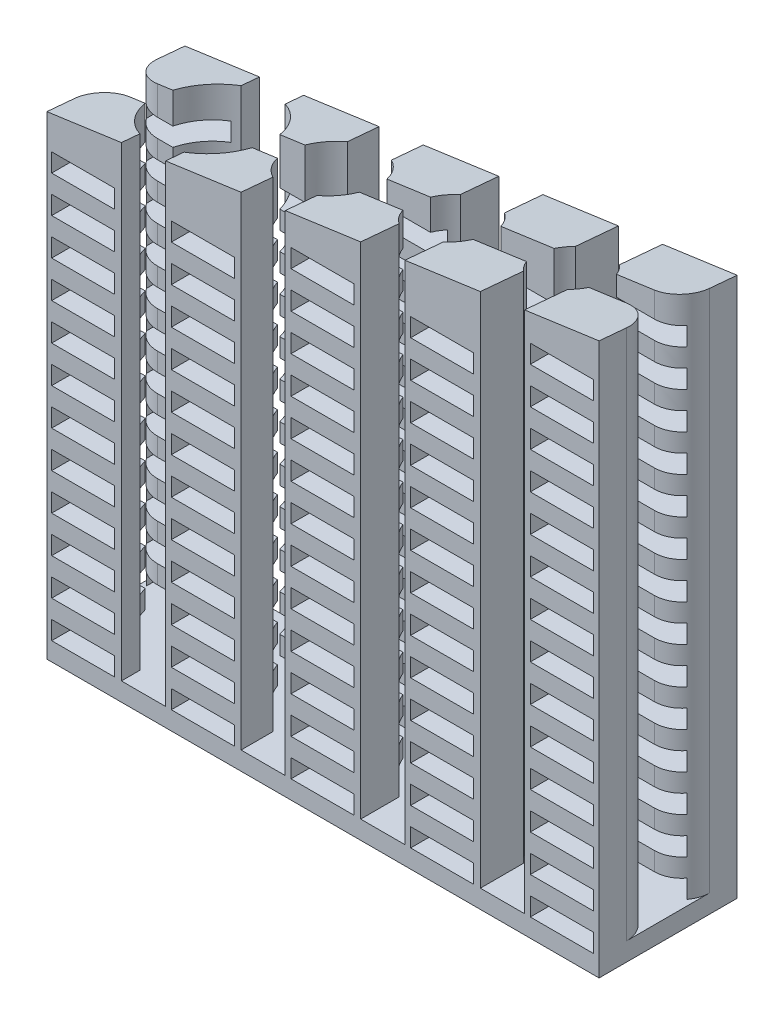
from build123d import *

# Parameters (mm, degrees)
SKETCH2_W            = 152.4
SKETCH2_H            = 38.1
BOSS_EXTRUDE1_DEPTH  = 152.4
SKETCH3_R            = 9.398
SKETCH3_R_2          = 10.414
SKETCH3_R_3          = 11.938
SKETCH3_R_4          = 15.24
CUT_EXTRUDE1_DEPTH   = 147.32
SKETCH6_W            = 201.922534325
SKETCH6_H            = 81.384049634
CUT_EXTRUDE12_DEPTH  = 21.336
SKETCH7_W            = 12.192
SKETCH7_H            = 152.907767239
CUT_EXTRUDE13_DEPTH  = 59.69
LPATTERN1_COUNT      = 4
LPATTERN1_PITCH      = 33.02
SKETCH8_W            = 7.62
SKETCH8_H            = 158.942717159
CUT_EXTRUDE14_DEPTH  = 199.136
SKETCH9_W            = 17.399
SKETCH9_H            = 5.08
CUT_EXTRUDE15_DEPTH  = 199.136
LPATTERN2_COUNT      = 5
LPATTERN2_PITCH      = 33.02
LPATTERN2_COUNT_DIR2 = 14
LPATTERN2_PITCH_DIR2 = 10.16
FILLET2_R            = 7.62
SKETCH10_W           = 242.916122525
SKETCH10_H           = 111.998594032
CUT_EXTRUDE16_DEPTH  = 16.256


with BuildPart() as part:
    # Sketch2 → Boss-Extrude1 (new body)
    with BuildSketch(Plane(origin=(0, 0, 0), x_dir=(1, 0, 0), z_dir=(0, 1, 0))):
        with Locations((-86.07386747, 25.062512801)):
            Rectangle(SKETCH2_W, SKETCH2_H)
    extrude(amount=BOSS_EXTRUDE1_DEPTH)

    # Sketch3 → Cut-Extrude1 (cut)
    with BuildSketch(Plane(origin=(0, 152.4, 0), x_dir=(1, 0, 0), z_dir=(0, 1, 0))):
        with Locations(Location((-36.54386747, 25.062512801, 0), (0, 0, 270))):
            Circle(SKETCH3_R)
        with Locations(Location((-69.56386747, 25.062512801, 0), (0, 0, 270))):
            Circle(SKETCH3_R_2)
        with Locations(Location((-102.58386747, 25.062512801, 0), (0, 0, 270))):
            Circle(SKETCH3_R_3)
        with Locations(Location((-135.60386747, 25.062512801, 0), (0, 0, 270))):
            Circle(SKETCH3_R_4)
    extrude(amount=-CUT_EXTRUDE1_DEPTH, mode=Mode.SUBTRACT)

    # Sketch6 → Cut-Extrude12 (cut)
    with BuildSketch(Plane(origin=(-24.146673723, 171.812511104, 0), x_dir=(0.9902680687415703, 0.13917310096006574, 0), z_dir=(-0.13917310096006574, 0.9902680687415703, 0))):
        with Locations((-69.496459483, 22.742168253)):
            Rectangle(SKETCH6_W, SKETCH6_H)
    extrude(amount=-CUT_EXTRUDE12_DEPTH, mode=Mode.SUBTRACT)

    # Sketch7 → Cut-Extrude13 (cut)
    with BuildSketch(Plane.XY.offset(-6.012512801)):
        with Locations((-36.54386747, 81.53388362)):
            Rectangle(SKETCH7_W, SKETCH7_H)
    cut_extrude13 = extrude(amount=-CUT_EXTRUDE13_DEPTH, mode=Mode.SUBTRACT)

    # LPattern1: Cut-Extrude13 ×4
    with Locations(*[(-i * LPATTERN1_PITCH, 0, 0) for i in range(1, LPATTERN1_COUNT)]):
        add(cut_extrude13, mode=Mode.SUBTRACT)

    # Sketch8 → Cut-Extrude14 (cut)
    with BuildSketch(Plane(origin=(-9.87386747, 0, 0), x_dir=(0, 0, -1), z_dir=(1, 0, 0))):
        with Locations((25.062512801, 84.55135858)):
            Rectangle(SKETCH8_W, SKETCH8_H)
    extrude(amount=-CUT_EXTRUDE14_DEPTH, mode=Mode.SUBTRACT)

    # Sketch9 → Cut-Extrude15 (cut)
    with BuildSketch(Plane.XY.offset(-6.012512801)):
        with Locations((-20.16086747, 7.62)):
            Rectangle(SKETCH9_W, SKETCH9_H)
    cut_extrude15 = extrude(amount=-CUT_EXTRUDE15_DEPTH, mode=Mode.SUBTRACT)

    # LPattern2: Cut-Extrude15 5 × 14, 6 skipped
    with Locations(*[(-i * LPATTERN2_PITCH, j * LPATTERN2_PITCH_DIR2, 0) for i in range(LPATTERN2_COUNT) for j in range(LPATTERN2_COUNT_DIR2) if (i, j) not in ((0, 0), (1, 13), (2, 13), (3, 12), (3, 13), (4, 12), (4, 13))]):
        add(cut_extrude15, mode=Mode.SUBTRACT)

    # Fillet2
    # the kernel refuses this fillet: 7.62 mm, written as the material it takes off along each edge
    with BuildSketch(Plane(origin=(-162.27386747, 5.08, -21.252512801), x_dir=(0, 0, 1), z_dir=(0, 1, 0))) as fillet2_piece_1_section:
        with BuildLine():
            CenterArc((FILLET2_R, FILLET2_R), FILLET2_R, 180, 90)
            Line((0, FILLET2_R), (-FILLET2_R * 0.02, FILLET2_R))
            Line((-FILLET2_R * 0.02, FILLET2_R), (-FILLET2_R * 0.02, -FILLET2_R * 0.02))
            Line((-FILLET2_R * 0.02, -FILLET2_R * 0.02), (FILLET2_R, -FILLET2_R * 0.02))
            Line((FILLET2_R, -FILLET2_R * 0.02), (FILLET2_R, 0))
        make_face()
    fillet2_piece_1 = extrude(amount=144.824318913, mode=Mode.PRIVATE)
    fillet2_piece_1 = split(fillet2_piece_1, bisect_by=Plane(origin=(-169.229488511, 129.876770126, -19.529160034), z_dir=(0.13917310096006574, -0.9902680687415703, 0)), keep=Keep.TOP, mode=Mode.PRIVATE)
    add(fillet2_piece_1, mode=Mode.SUBTRACT)
    with BuildSketch(Plane(origin=(-162.27386747, 149.904318913, -28.872512801), x_dir=(0, 0, -1), z_dir=(0, -1, 0))) as fillet2_piece_2_section:
        with BuildLine():
            CenterArc((FILLET2_R, FILLET2_R), FILLET2_R, 180, 90)
            Line((0, FILLET2_R), (-FILLET2_R * 0.02, FILLET2_R))
            Line((-FILLET2_R * 0.02, FILLET2_R), (-FILLET2_R * 0.02, -FILLET2_R * 0.02))
            Line((-FILLET2_R * 0.02, -FILLET2_R * 0.02), (FILLET2_R, -FILLET2_R * 0.02))
            Line((FILLET2_R, -FILLET2_R * 0.02), (FILLET2_R, 0))
        make_face()
    fillet2_piece_2 = extrude(amount=144.824318913, mode=Mode.PRIVATE)
    fillet2_piece_2 = split(fillet2_piece_2, bisect_by=Plane(origin=(-169.229488511, 129.876770126, -30.595865568), z_dir=(0.13917310096006574, -0.9902680687415703, 0)), keep=Keep.TOP, mode=Mode.PRIVATE)
    add(fillet2_piece_2, mode=Mode.SUBTRACT)
    with BuildSketch(Plane(origin=(-9.87386747, 171.322742121, -21.252512801), x_dir=(0, 0, 1), z_dir=(0, -1, 0))) as fillet2_piece_3_section:
        with BuildLine():
            CenterArc((FILLET2_R, FILLET2_R), FILLET2_R, 180, 90)
            Line((0, FILLET2_R), (-FILLET2_R * 0.02, FILLET2_R))
            Line((-FILLET2_R * 0.02, FILLET2_R), (-FILLET2_R * 0.02, -FILLET2_R * 0.02))
            Line((-FILLET2_R * 0.02, -FILLET2_R * 0.02), (FILLET2_R, -FILLET2_R * 0.02))
            Line((FILLET2_R, -FILLET2_R * 0.02), (FILLET2_R, 0))
        make_face()
    fillet2_piece_3 = extrude(amount=166.242742121, mode=Mode.PRIVATE)
    fillet2_piece_3 = split(fillet2_piece_3, bisect_by=Plane(origin=(-21.722689701, 150.607498755, -19.525857309), z_dir=(0.13917310096006574, -0.9902680687415703, 0)), keep=Keep.TOP, mode=Mode.PRIVATE)
    add(fillet2_piece_3, mode=Mode.SUBTRACT)
    with BuildSketch(Plane(origin=(-9.87386747, 5.08, -28.872512801), x_dir=(0, 0, -1), z_dir=(0, 1, 0))) as fillet2_piece_4_section:
        with BuildLine():
            CenterArc((FILLET2_R, FILLET2_R), FILLET2_R, 180, 90)
            Line((0, FILLET2_R), (-FILLET2_R * 0.02, FILLET2_R))
            Line((-FILLET2_R * 0.02, FILLET2_R), (-FILLET2_R * 0.02, -FILLET2_R * 0.02))
            Line((-FILLET2_R * 0.02, -FILLET2_R * 0.02), (FILLET2_R, -FILLET2_R * 0.02))
            Line((FILLET2_R, -FILLET2_R * 0.02), (FILLET2_R, 0))
        make_face()
    fillet2_piece_4 = extrude(amount=166.242742121, mode=Mode.PRIVATE)
    fillet2_piece_4 = split(fillet2_piece_4, bisect_by=Plane(origin=(-21.722689701, 150.607498755, -30.599168293), z_dir=(0.13917310096006574, -0.9902680687415703, 0)), keep=Keep.TOP, mode=Mode.PRIVATE)
    add(fillet2_piece_4, mode=Mode.SUBTRACT)

    # Sketch10 → Cut-Extrude16 (cut)
    with BuildSketch(Plane(origin=(-21.089063899, 150.056486742, -13.257260224), x_dir=(0.9902680687415701, 0.13917310096006622, 0), z_dir=(-0.1386435052934052, 0.9864997997699045, -0.08715574274765837))):
        with Locations((-78.246671801, 29.182123031)):
            Rectangle(SKETCH10_W, SKETCH10_H)
    extrude(amount=CUT_EXTRUDE16_DEPTH, mode=Mode.SUBTRACT)


solid = part.part
